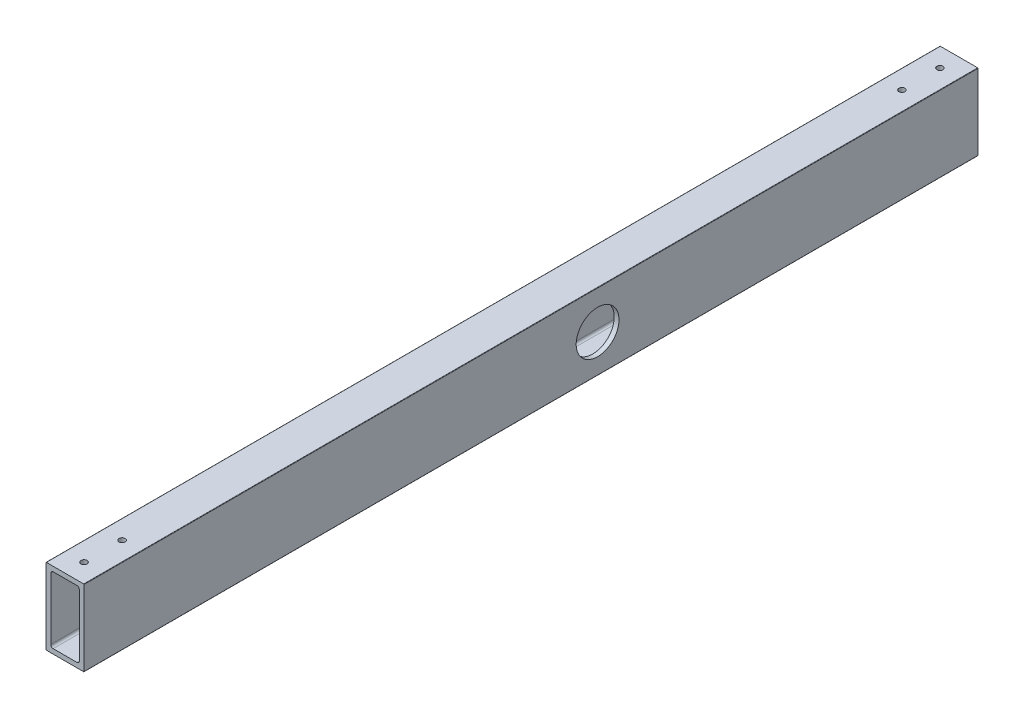
from build123d import *

# Parameters (mm, degrees)
BOSS_EXTRUDE1_DEPTH = 596.9
SKETCH2_R           = 2.032
CUT_EXTRUDE1_DEPTH  = 600.596039013
SKETCH5_R           = 14.2875
CUT_EXTRUDE2_DEPTH  = 600.596039013


with BuildPart() as part:
    # Sketch1 → Boss-Extrude1 (new body)
    with BuildSketch(Plane(origin=(0, 0, 0), x_dir=(-1, 0, 0), z_dir=(0, 0, -1))):
        with BuildLine():
            Line((0, 0.254), (0, 50.546))
            ThreePointArc((0, 50.546), (-0.074394878, 50.725605122), (-0.254, 50.8))
            Line((-0.254, 50.8), (-25.146, 50.8))
            ThreePointArc((-25.146, 50.8), (-25.325605122, 50.725605122), (-25.4, 50.546))
            Line((-25.4, 50.546), (-25.4, 0.254))
            ThreePointArc((-25.4, 0.254), (-25.325605122, 0.074394878), (-25.146, 0))
            Line((-25.146, 0), (-0.254, 0))
            ThreePointArc((-0.254, 0), (-0.074394878, 0.074394878), (0, 0.254))
        make_face()
        with BuildLine():
            Line((-3.175, 46.0375), (-3.175, 4.7625))
            ThreePointArc((-3.175, 4.7625), (-3.639967985, 3.639967985), (-4.7625, 3.175))
            Line((-4.7625, 3.175), (-20.6375, 3.175))
            ThreePointArc((-20.6375, 3.175), (-21.760032015, 3.639967985), (-22.225, 4.7625))
            Line((-22.225, 4.7625), (-22.225, 46.0375))
            ThreePointArc((-22.225, 46.0375), (-21.760032015, 47.160032015), (-20.6375, 47.625))
            Line((-20.6375, 47.625), (-4.7625, 47.625))
            ThreePointArc((-4.7625, 47.625), (-3.639967985, 47.160032015), (-3.175, 46.0375))
        make_face(mode=Mode.SUBTRACT)
    extrude(amount=-BOSS_EXTRUDE1_DEPTH)

    # Sketch2 → Cut-Extrude1 (cut, through all)
    with BuildSketch(Plane(origin=(0, 50.8, 0), x_dir=(1, 0, 0), z_dir=(0, 1, 0))):
        with Locations((12.7, -584.2)):
            Circle(SKETCH2_R)
        with Locations((12.7, -558.8)):
            Circle(SKETCH2_R)
        with Locations((12.7, -38.1)):
            Circle(SKETCH2_R)
        with Locations((12.7, -12.7)):
            Circle(SKETCH2_R)
    extrude(amount=-CUT_EXTRUDE1_DEPTH, mode=Mode.SUBTRACT)

    # Sketch5 → Cut-Extrude2 (cut, through all)
    with BuildSketch(Plane(origin=(25.4, 0, 0), x_dir=(0, 0, -1), z_dir=(1, 0, 0))):
        with Locations((-254, 25.146)):
            Circle(SKETCH5_R)
    extrude(amount=-CUT_EXTRUDE2_DEPTH, mode=Mode.SUBTRACT)


solid = part.part
